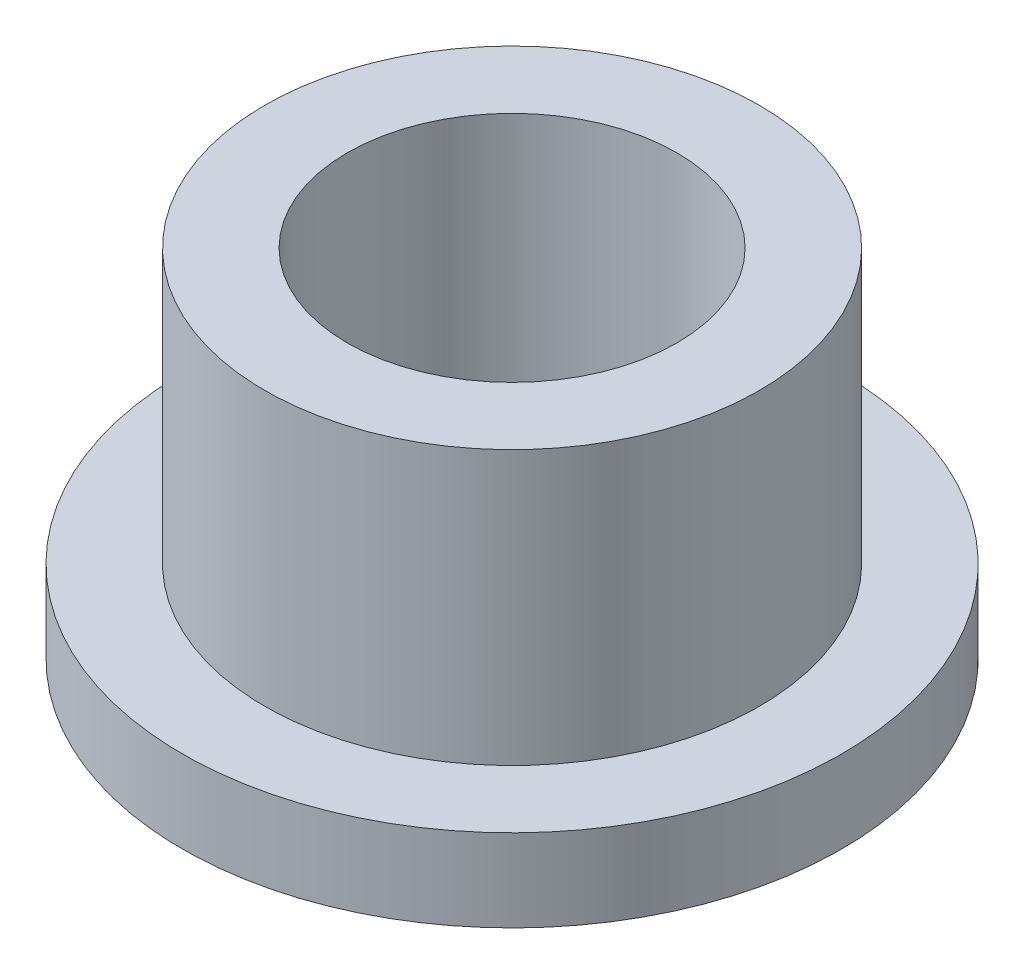
from build123d import *


with BuildPart() as part:
    # Sketch1 → Revolve1 (revolve)
    with BuildSketch(Plane.XY):
        Polygon((3.175, 0), (6.35, 0), (6.35, 1.5875), (4.7625, 1.5875), (4.7625, 6.858), (3.175, 6.858), align=None)
    revolve(axis=Axis((0, 0, 0), (0, 1, 0)))


solid = part.part
